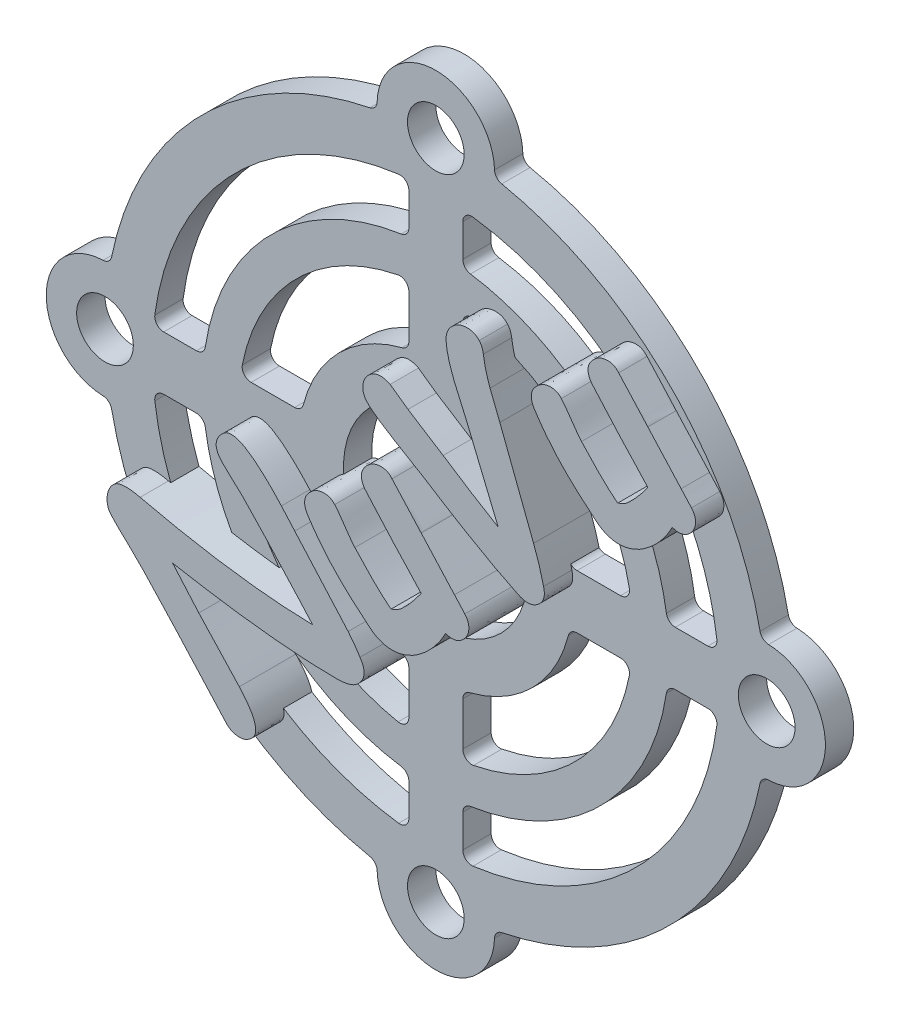
from build123d import *

# Parameters (mm, degrees)
SKETCH1_R           = 2
SKETCH1_R_2         = 6.511212715
BOSS_EXTRUDE1_DEPTH = 2
BOSS_EXTRUDE2_START = -2
BOSS_EXTRUDE2_DEPTH = 4


# Read off the part's stored shape, not the designer's step: Boss-Extrude2
with BuildPart() as part:
    # Sketch1 → Boss-Extrude1 (new body)
    with BuildSketch(Plane.XY):
        with BuildLine():
            ThreePointArc((4.142051136, 23.475771085), (0, 27.486125513), (-4.142051136, 23.475771085))
            ThreePointArc((-4.142051136, 23.475771085), (-4.291564648, 23.086587368), (-4.650214057, 22.87401066))
            ThreePointArc((-4.650214057, 22.87401066), (-16.505224241, 16.505224241), (-22.87401066, 4.650214057))
            ThreePointArc((-22.87401066, 4.650214057), (-23.086587368, 4.291564648), (-23.475771085, 4.142051136))
            ThreePointArc((-23.475771085, 4.142051136), (-27.486125513, 0), (-23.475771085, -4.142051136))
            ThreePointArc((-23.475771085, -4.142051136), (-23.086587368, -4.291564648), (-22.87401066, -4.650214057))
            ThreePointArc((-22.87401066, -4.650214057), (-16.505224241, -16.505224241), (-4.650214057, -22.87401066))
            ThreePointArc((-4.650214057, -22.87401066), (-4.291564648, -23.086587368), (-4.142051136, -23.475771085))
            ThreePointArc((-4.142051136, -23.475771085), (0, -27.486125513), (4.142051136, -23.475771085))
            ThreePointArc((4.142051136, -23.475771085), (4.291564648, -23.086587368), (4.650214057, -22.87401066))
            ThreePointArc((4.650214057, -22.87401066), (16.505224241, -16.505224241), (22.87401066, -4.650214057))
            ThreePointArc((22.87401066, -4.650214057), (23.086587368, -4.291564648), (23.475771085, -4.142051136))
            ThreePointArc((23.475771085, -4.142051136), (27.486125513, 0), (23.475771085, 4.142051136))
            ThreePointArc((23.475771085, 4.142051136), (23.086587368, 4.291564648), (22.87401066, 4.650214057))
            ThreePointArc((22.87401066, 4.650214057), (16.505224241, 16.505224241), (4.650214057, 22.87401066))
            ThreePointArc((4.650214057, 22.87401066), (4.291564648, 23.086587368), (4.142051136, 23.475771085))
        make_face()
        with Locations((23.341911971, 0)):
            Circle(SKETCH1_R, mode=Mode.SUBTRACT)
        with Locations((0, -23.341911971)):
            Circle(SKETCH1_R, mode=Mode.SUBTRACT)
        with Locations((-23.341911971, 0)):
            Circle(SKETCH1_R, mode=Mode.SUBTRACT)
        Circle(SKETCH1_R_2, mode=Mode.SUBTRACT)
        with BuildLine():
            Line((-9.961790789, 1.905), (-13.030671632, 1.905))
            ThreePointArc((-13.030671632, 1.905), (-13.520759158, 2.13621885), (-13.653941254, 2.661490655))
            ThreePointArc((-13.653941254, 2.661490655), (-9.836504569, 9.836504569), (-2.661490655, 13.653941254))
            ThreePointArc((-2.661490655, 13.653941254), (-2.13621885, 13.520759158), (-1.905, 13.030671632))
            Line((-1.905, 13.030671632), (-1.905, 9.961790789))
            ThreePointArc((-1.905, 9.961790789), (-2.038577231, 9.572175328), (-2.383110889, 9.346477205))
            ThreePointArc((-2.383110889, 9.346477205), (-6.82040518, 6.82040518), (-9.346477205, 2.383110889))
            ThreePointArc((-9.346477205, 2.383110889), (-9.572175328, 2.038577231), (-9.961790789, 1.905))
        make_face(mode=Mode.SUBTRACT)
        with BuildLine():
            Line((-9.961790789, -1.905), (-13.030671632, -1.905))
            ThreePointArc((-13.030671632, -1.905), (-13.520759158, -2.13621885), (-13.653941254, -2.661490655))
            ThreePointArc((-13.653941254, -2.661490655), (-9.836504569, -9.836504569), (-2.661490655, -13.653941254))
            ThreePointArc((-2.661490655, -13.653941254), (-2.13621885, -13.520759158), (-1.905, -13.030671632))
            Line((-1.905, -13.030671632), (-1.905, -9.961790789))
            ThreePointArc((-1.905, -9.961790789), (-2.038577231, -9.572175328), (-2.383110889, -9.346477205))
            ThreePointArc((-2.383110889, -9.346477205), (-6.82040518, -6.82040518), (-9.346477205, -2.383110889))
            ThreePointArc((-9.346477205, -2.383110889), (-9.572175328, -2.038577231), (-9.961790789, -1.905))
        make_face(mode=Mode.SUBTRACT)
        with BuildLine():
            Line((1.905, 9.961790789), (1.905, 13.030671632))
            ThreePointArc((1.905, 13.030671632), (2.13621885, 13.520759158), (2.661490655, 13.653941254))
            ThreePointArc((2.661490655, 13.653941254), (9.836504569, 9.836504569), (13.653941254, 2.661490655))
            ThreePointArc((13.653941254, 2.661490655), (13.520759158, 2.13621885), (13.030671632, 1.905))
            Line((13.030671632, 1.905), (9.961790789, 1.905))
            ThreePointArc((9.961790789, 1.905), (9.572175328, 2.038577231), (9.346477205, 2.383110889))
            ThreePointArc((9.346477205, 2.383110889), (6.82040518, 6.82040518), (2.383110889, 9.346477205))
            ThreePointArc((2.383110889, 9.346477205), (2.038577231, 9.572175328), (1.905, 9.961790789))
        make_face(mode=Mode.SUBTRACT)
        with BuildLine():
            Line((9.961790789, -1.905), (13.030671632, -1.905))
            ThreePointArc((13.030671632, -1.905), (13.520759158, -2.13621885), (13.653941254, -2.661490655))
            ThreePointArc((13.653941254, -2.661490655), (9.836504569, -9.836504569), (2.661490655, -13.653941254))
            ThreePointArc((2.661490655, -13.653941254), (2.13621885, -13.520759158), (1.905, -13.030671632))
            Line((1.905, -13.030671632), (1.905, -9.961790789))
            ThreePointArc((1.905, -9.961790789), (2.038577231, -9.572175328), (2.383110889, -9.346477205))
            ThreePointArc((2.383110889, -9.346477205), (6.82040518, -6.82040518), (9.346477205, -2.383110889))
            ThreePointArc((9.346477205, -2.383110889), (9.572175328, -2.038577231), (9.961790789, -1.905))
        make_face(mode=Mode.SUBTRACT)
        with BuildLine():
            Line((-16.893355295, 1.905), (-19.19769843, 1.905))
            ThreePointArc((-19.19769843, 1.905), (-19.67525146, 2.121469114), (-19.827212424, 2.62328944))
            ThreePointArc((-19.827212424, 2.62328944), (-14.142135624, 14.142135624), (-2.62328944, 19.827212424))
            ThreePointArc((-2.62328944, 19.827212424), (-2.121469114, 19.67525146), (-1.905, 19.19769843))
            Line((-1.905, 19.19769843), (-1.905, 16.893355295))
            ThreePointArc((-1.905, 16.893355295), (-2.05876305, 16.479065544), (-2.44558582, 16.265413449))
            ThreePointArc((-2.44558582, 16.265413449), (-11.630661302, 11.630661302), (-16.265413449, 2.44558582))
            ThreePointArc((-16.265413449, 2.44558582), (-16.479065544, 2.05876305), (-16.893355295, 1.905))
        make_face(mode=Mode.SUBTRACT)
        with BuildLine():
            Line((-16.893355295, -1.905), (-19.19769843, -1.905))
            ThreePointArc((-19.19769843, -1.905), (-19.67525146, -2.121469114), (-19.827212424, -2.62328944))
            ThreePointArc((-19.827212424, -2.62328944), (-14.142135624, -14.142135624), (-2.62328944, -19.827212424))
            ThreePointArc((-2.62328944, -19.827212424), (-2.121469114, -19.67525146), (-1.905, -19.19769843))
            Line((-1.905, -19.19769843), (-1.905, -16.893355295))
            ThreePointArc((-1.905, -16.893355295), (-2.05876305, -16.479065544), (-2.44558582, -16.265413449))
            ThreePointArc((-2.44558582, -16.265413449), (-11.630661302, -11.630661302), (-16.265413449, -2.44558582))
            ThreePointArc((-16.265413449, -2.44558582), (-16.479065544, -2.05876305), (-16.893355295, -1.905))
        make_face(mode=Mode.SUBTRACT)
        with BuildLine():
            Line((1.905, 16.893355295), (1.905, 19.19769843))
            ThreePointArc((1.905, 19.19769843), (2.121469114, 19.67525146), (2.62328944, 19.827212424))
            ThreePointArc((2.62328944, 19.827212424), (14.142135624, 14.142135624), (19.827212424, 2.62328944))
            ThreePointArc((19.827212424, 2.62328944), (19.67525146, 2.121469114), (19.19769843, 1.905))
            Line((19.19769843, 1.905), (16.893355295, 1.905))
            ThreePointArc((16.893355295, 1.905), (16.479065544, 2.05876305), (16.265413449, 2.44558582))
            ThreePointArc((16.265413449, 2.44558582), (11.630661302, 11.630661302), (2.44558582, 16.265413449))
            ThreePointArc((2.44558582, 16.265413449), (2.05876305, 16.479065544), (1.905, 16.893355295))
        make_face(mode=Mode.SUBTRACT)
        with BuildLine():
            Line((1.905, -16.893355295), (1.905, -19.19769843))
            ThreePointArc((1.905, -19.19769843), (2.121469114, -19.67525146), (2.62328944, -19.827212424))
            ThreePointArc((2.62328944, -19.827212424), (14.142135624, -14.142135624), (19.827212424, -2.62328944))
            ThreePointArc((19.827212424, -2.62328944), (19.67525146, -2.121469114), (19.19769843, -1.905))
            Line((19.19769843, -1.905), (16.893355295, -1.905))
            ThreePointArc((16.893355295, -1.905), (16.479065544, -2.05876305), (16.265413449, -2.44558582))
            ThreePointArc((16.265413449, -2.44558582), (11.630661302, -11.630661302), (2.44558582, -16.265413449))
            ThreePointArc((2.44558582, -16.265413449), (2.05876305, -16.479065544), (1.905, -16.893355295))
        make_face(mode=Mode.SUBTRACT)
        with BuildLine():
            ThreePointArc((0, 25.341911971), (-1.444189317, 21.958323443), (1.998163772, 23.256229187))
            ThreePointArc((1.998163772, 23.256229187), (1.444189317, 24.7255005), (0, 25.341911971))
        make_face(mode=Mode.SUBTRACT)
    extrude(amount=BOSS_EXTRUDE1_DEPTH)

    # Boss-Extrude2 outline → Boss-Extrude2 (add)
    with BuildSketch(Plane.XY.offset(2).offset(BOSS_EXTRUDE2_START)):
        with BuildLine():
            add(Edge.make_bspline(
                [(-7.952972933, -3.641911337), (-7.830138747, -3.781206227), (-7.590593042, -4.052852858), (-7.240831947, -4.451010242), (-6.905379607, -4.826385854), (-6.590258394, -5.184313096), (-6.292319924, -5.521232132), (-6.012727395, -5.837302729), (-5.750957135, -6.133702264), (-5.505732508, -6.408533587), (-5.281481464, -6.666476817), (-5.071956207, -6.9003705), (-4.882005474, -7.116062421), (-4.705506042, -7.307397225), (-4.552586947, -7.48420682), (-4.41401583, -7.637478445), (-4.293053896, -7.770884261), (-4.219588264, -7.854111728), (-4.1857036, -7.892498857)],
                knots=[0, 0, 0, 0, 0.098094022, 0.191298549, 0.279918503, 0.36399329, 0.443178607, 0.51747446, 0.58688086, 0.652047129, 0.712019608, 0.767407079, 0.817905188, 0.863821415, 0.904884984, 0.941364819, 0.972955608, 1, 1, 1, 1], degree=3))
            add(Edge.make_bspline(
                [(-8.893484, -2.578611325), (-8.88384894, -2.589011527), (-8.855338663, -2.619785871), (-8.802460367, -2.682519416), (-8.719120291, -2.770213785), (-8.617247774, -2.891755178), (-8.484954724, -3.036681692), (-8.330583118, -3.213163533), (-8.151717175, -3.419039616), (-8.021947798, -3.564562949), (-7.952972933, -3.641911337)],
                knots=[0, 0, 0, 0, 0.029958341, 0.088647152, 0.173322162, 0.285506617, 0.42366598, 0.587960845, 0.78099344, 1, 1, 1, 1], degree=3))
            add(Edge.make_bspline(
                [(-12.989932206, -0.185533164), (-12.94448893, -0.14817682), (-12.85482639, -0.074470322), (-12.69245497, -0.008037712), (-12.518316117, 0.030433409), (-12.328462343, 0.031110398), (-12.123691192, -0.002566043), (-11.904441366, -0.068928681), (-11.670708145, -0.170659881), (-11.422114584, -0.305071186), (-11.159302558, -0.474091462), (-10.878111033, -0.671839784), (-10.587531227, -0.910576115), (-10.274667799, -1.174890577), (-9.953157849, -1.481123686), (-9.609816896, -1.813645098), (-9.254799331, -2.183456101), (-9.016581554, -2.443984761), (-8.893484, -2.578611325)],
                knots=[0, 0, 0, 0, 0.034447789, 0.067967728, 0.102051264, 0.138962514, 0.178909684, 0.22383522, 0.273441684, 0.328712966, 0.390005396, 0.457281989, 0.53093344, 0.611275463, 0.698316041, 0.792201487, 0.892621412, 1, 1, 1, 1], degree=3))
            add(Edge.make_bspline(
                [(-13.15417234, -1.917125554), (-13.201768381, -1.859711036), (-13.302371801, -1.733917722), (-13.42116071, -1.523163482), (-13.491657592, -1.291923667), (-13.506185307, -1.061607324), (-13.462252079, -0.832746752), (-13.358882478, -0.608471629), (-13.199932106, -0.387187335), (-13.062897782, -0.255598971), (-12.989932206, -0.185533164)],
                knots=[0.033497037, 0.033497037, 0.033497037, 0.033497037, 0.142535772, 0.269186179, 0.384924547, 0.493454852, 0.603700601, 0.722377591, 0.852176607, 1, 1, 1, 1], degree=3))
            ThreePointArc((-13.15417234, -1.917125554), (-13.0927189, -1.908038659), (-13.030671632, -1.905))
            Line((-13.030671632, -1.905), (-9.961790789, -1.905))
            ThreePointArc((-9.961790789, -1.905), (-9.572175328, -2.038577231), (-9.346477205, -2.383110889))
            ThreePointArc((-9.346477205, -2.383110889), (-7.168363584, -6.45371344), (-3.348018702, -9.045807008))
            add(Edge.make_bspline(
                [(-4.1857036, -7.892498857), (-4.130156836, -7.957260454), (-4.004175549, -8.104141183), (-3.811184021, -8.363945819), (-3.586030095, -8.682673735), (-3.431386951, -8.91859969), (-3.348018702, -9.045807008)],
                knots=[0, 0, 0, 0, 0.179163764, 0.406347368, 0.679375824, 0.998802688, 0.998802688, 0.998802688, 0.998802688], degree=3))
        make_face()
        with BuildLine():
            add(Edge.make_bspline(
                [(-3.348018702, -9.045807008), (-3.347706212, -9.04628382), (-3.347393722, -9.046760633), (-3.347081232, -9.047237446)],
                knots=[0.998802688, 0.998802688, 0.998802688, 0.998802688, 1, 1, 1, 1], degree=3))
            ThreePointArc((-3.348018702, -9.045807008), (-7.168363584, -6.45371344), (-9.346477205, -2.383110889))
            ThreePointArc((-9.346477205, -2.383110889), (-9.572175328, -2.038577231), (-9.961790789, -1.905))
            Line((-9.961790789, -1.905), (-13.030671632, -1.905))
            ThreePointArc((-13.030671632, -1.905), (-13.0927189, -1.908038659), (-13.15417234, -1.917125554))
            add(Edge.make_bspline(
                [(-13.110108621, -1.969891661), (-13.124829655, -1.952327567), (-13.139550689, -1.934763472), (-13.15417234, -1.917125554)],
                knots=[0, 0, 0, 0, 0.033497037, 0.033497037, 0.033497037, 0.033497037], degree=3))
            add(Edge.make_bspline(
                [(-12.394275197, -2.656987247), (-12.468478951, -2.590130983), (-12.608143807, -2.464295429), (-12.802269769, -2.283958079), (-12.967776341, -2.122701812), (-13.065177705, -2.018130192), (-13.110108621, -1.969891661)],
                knots=[0, 0, 0, 0, 0.301857621, 0.568150516, 0.800789311, 1, 1, 1, 1], degree=3))
            add(Edge.make_bspline(
                [(-11.673216712, -3.320570056), (-11.711358958, -3.282941354), (-11.800384397, -3.195114547), (-11.959758861, -3.047947777), (-12.1616142, -2.86399382), (-12.312256505, -2.729962127), (-12.394275197, -2.656987247)],
                knots=[0, 0, 0, 0, 0.16400097, 0.382784445, 0.663950887, 1, 1, 1, 1], degree=3))
            add(Edge.make_bspline(
                [(-7.602893813, -7.714846767), (-7.725139303, -7.581033204), (-7.964258785, -7.319285882), (-8.310106142, -6.929667989), (-8.649038416, -6.564542776), (-8.965804331, -6.208552381), (-9.275831804, -5.877262542), (-9.564333821, -5.556447478), (-9.841723118, -5.257224063), (-10.103324945, -4.973715275), (-10.35112986, -4.709369515), (-10.581341373, -4.458155758), (-10.800520741, -4.228706071), (-11.001904409, -4.011338438), (-11.19228602, -3.815829231), (-11.364237145, -3.633420783), (-11.524536937, -3.472325114), (-11.625380482, -3.369395727), (-11.673216712, -3.320570056)],
                knots=[0, 0, 0, 0, 0.090770468, 0.177552459, 0.260900938, 0.340259436, 0.416186926, 0.488122675, 0.55633416, 0.620527464, 0.681319351, 0.737796659, 0.791171036, 0.840229863, 0.886189827, 0.927833247, 0.965766917, 1, 1, 1, 1], degree=3))
            add(Edge.make_bspline(
                [(-6.691120584, -8.736346287), (-6.709531383, -8.715552171), (-6.752113656, -8.667457532), (-6.820792431, -8.58323415), (-6.91198559, -8.484276417), (-7.016971362, -8.364728245), (-7.140860291, -8.228989289), (-7.279930785, -8.073742211), (-7.435171299, -7.899868001), (-7.545334307, -7.778342898), (-7.602893813, -7.714846767)],
                knots=[0, 0, 0, 0, 0.060845347, 0.140728989, 0.238015712, 0.355583189, 0.48931671, 0.640635278, 0.812234105, 1, 1, 1, 1], degree=3))
            add(Edge.make_bspline(
                [(-11.063197867, -8.43322579), (-11.009649463, -8.43943999), (-10.473638222, -8.500685251), (-9.46898069, -8.596693462), (-8.06487309, -8.698917744), (-7.143245897, -8.724027917), (-6.691120584, -8.736346287)],
                knots=[0.643935213, 0.643935213, 0.643935213, 0.643935213, 0.657070137, 0.775387425, 0.889811161, 1, 1, 1, 1], degree=3))
            ThreePointArc((-11.063197867, -8.43322579), (-9.853945707, -9.819032452), (-8.472439833, -11.033195708))
            add(Edge.make_bspline(
                [(-5.037388623, -11.186900125), (-5.232467594, -11.185860998), (-5.628781583, -11.183749952), (-6.231482984, -11.167305449), (-6.852471118, -11.141269456), (-7.490752117, -11.103820994), (-8.033131875, -11.067672287), (-8.362014693, -11.042143766), (-8.472439833, -11.033195708)],
                knots=[0, 0, 0, 0, 0.050388515, 0.102367124, 0.155725282, 0.210925426, 0.267514655, 0.296130816, 0.296130816, 0.296130816, 0.296130816], degree=3))
            add(Edge.make_bspline(
                [(-3.527345853, -10.771507737), (-3.568498955, -10.804593949), (-3.652624829, -10.872229349), (-3.795215727, -10.960019544), (-3.958059575, -11.028673719), (-4.138350731, -11.086197381), (-4.336274479, -11.134064046), (-4.554330168, -11.162633409), (-4.789578118, -11.185795771), (-4.952849036, -11.186523379), (-5.037388623, -11.186900125)],
                knots=[0, 0, 0, 0, 0.098975589, 0.202327589, 0.312765512, 0.429484919, 0.557035531, 0.693993699, 0.841553862, 1, 1, 1, 1], degree=3))
            add(Edge.make_bspline(
                [(-3.347081232, -9.047237446), (-3.298635055, -9.126111587), (-3.206382782, -9.276305458), (-3.109473171, -9.511968733), (-3.060267028, -9.742274204), (-3.059156105, -9.966869859), (-3.108178639, -10.18302377), (-3.202815768, -10.391216748), (-3.343413331, -10.591662307), (-3.464271507, -10.709834941), (-3.527345853, -10.771507737)],
                knots=[0, 0, 0, 0, 0.14400734, 0.274221937, 0.394721626, 0.508653217, 0.621195792, 0.737151961, 0.862822948, 1, 1, 1, 1], degree=3))
        make_face()
        with BuildLine():
            ThreePointArc((-8.472439833, -11.033195708), (-9.853945707, -9.819032452), (-11.063197867, -8.43322579))
            add(Edge.make_bspline(
                [(-14.400179875, -7.948546045), (-14.248927748, -7.97487886), (-13.58351401, -8.088139215), (-12.471800007, -8.255402878), (-11.509314509, -8.38145472), (-11.063197867, -8.43322579)],
                knots=[0.370044474, 0.370044474, 0.370044474, 0.370044474, 0.407451735, 0.534506967, 0.643935213, 0.643935213, 0.643935213, 0.643935213], degree=3))
            ThreePointArc((-14.400179875, -7.948546045), (-13.568434868, -9.297426519), (-12.610743454, -10.560005406))
            add(Edge.make_bspline(
                [(-8.472439833, -11.033195708), (-8.587566061, -11.023866708), (-8.933637568, -10.994592231), (-9.517438006, -10.939487143), (-10.228791975, -10.863090342), (-10.958762859, -10.780107112), (-11.705953825, -10.685727106), (-12.258511161, -10.61022476), (-12.562106533, -10.566979457), (-12.610743454, -10.560005406)],
                knots=[0.296130816, 0.296130816, 0.296130816, 0.296130816, 0.325965242, 0.38583895, 0.447593006, 0.510762643, 0.575603065, 0.64212175, 0.654813134, 0.654813134, 0.654813134, 0.654813134], degree=3))
        make_face()
        with BuildLine():
            ThreePointArc((-12.610743454, -10.560005406), (-13.568434868, -9.297426519), (-14.400179875, -7.948546045))
            add(Edge.make_bspline(
                [(-18.709321045, -7.068331208), (-18.199434601, -7.185663405), (-17.145641856, -7.42672801), (-15.707268303, -7.711912846), (-14.779713434, -7.882469703), (-14.400179875, -7.948546045)],
                knots=[0.01279887, 0.01279887, 0.01279887, 0.01279887, 0.140273223, 0.276179276, 0.370044474, 0.370044474, 0.370044474, 0.370044474], degree=3))
            ThreePointArc((-18.709321045, -7.068331208), (-15.522804921, -12.611206421), (-10.749960948, -16.865299868))
            add(Edge.make_bspline(
                [(-11.866543987, -15.108308771), (-11.797426236, -15.187274853), (-11.663537193, -15.340241248), (-11.474328885, -15.566996406), (-11.30768989, -15.786284082), (-11.159982111, -15.995504096), (-11.034056584, -16.196799498), (-10.929176423, -16.389617739), (-10.845262458, -16.574033159), (-10.784256315, -16.730547574), (-10.758565186, -16.827904573), (-10.749960948, -16.865299868)],
                knots=[0, 0, 0, 0, 0.09964103, 0.19301615, 0.280333667, 0.361077268, 0.43610193, 0.505655417, 0.569295761, 0.628425417, 0.664829705, 0.664829705, 0.664829705, 0.664829705], degree=3))
            add(Edge.make_bspline(
                [(-14.722040089, -12.030747555), (-14.680279968, -12.076938907), (-14.592634713, -12.173884333), (-14.452480147, -12.327203391), (-14.297380697, -12.495196467), (-14.12592522, -12.679102604), (-13.941225443, -12.880125749), (-13.740844105, -13.096833817), (-13.522275281, -13.326857582), (-13.295584501, -13.569515347), (-13.068974582, -13.812248195), (-12.850184896, -14.042066881), (-12.650131857, -14.259888423), (-12.462602275, -14.459092556), (-12.291312339, -14.643961034), (-12.136079233, -14.811830004), (-11.995954616, -14.96517687), (-11.908305804, -15.062118993), (-11.866543987, -15.108308771)],
                knots=[0, 0, 0, 0, 0.044496333, 0.093387958, 0.148434304, 0.207877584, 0.273053875, 0.343506384, 0.418781774, 0.499788285, 0.580794797, 0.656070187, 0.726522696, 0.792122416, 0.851565696, 0.906612042, 0.955503667, 1, 1, 1, 1], degree=3))
            add(Edge.make_bspline(
                [(-16.566486794, -9.909372591), (-16.447004922, -10.046814094), (-16.220561175, -10.307295188), (-15.901627435, -10.679595663), (-15.618321994, -11.009187219), (-15.365351015, -11.292285857), (-15.155531158, -11.538439641), (-14.979774058, -11.740619252), (-14.838855151, -11.899358729), (-14.756877954, -11.991563343), (-14.722040089, -12.030747555)],
                knots=[0, 0, 0, 0, 0.194350452, 0.368335745, 0.523170047, 0.658156837, 0.773475334, 0.868333145, 0.944045512, 1, 1, 1, 1], degree=3))
            add(Edge.make_bspline(
                [(-12.610743454, -10.560005406), (-12.823482778, -10.529500703), (-13.303801894, -10.45863845), (-14.057052454, -10.339936671), (-14.87766957, -10.207446945), (-15.716334568, -10.063776136), (-16.280935965, -9.961233962), (-16.566486794, -9.909372591)],
                knots=[0.654813134, 0.654813134, 0.654813134, 0.654813134, 0.710325622, 0.780221106, 0.851777764, 0.92503564, 1, 1, 1, 1], degree=3))
        make_face()
        with BuildLine():
            ThreePointArc((-10.749960948, -16.865299868), (-15.522804921, -12.611206421), (-18.709321045, -7.068331208))
            add(Edge.make_bspline(
                [(-18.862901318, -7.032976243), (-18.811708371, -7.044763444), (-18.760515425, -7.056550645), (-18.709321045, -7.068331208)],
                knots=[0, 0, 0, 0, 0.01279887, 0.01279887, 0.01279887, 0.01279887], degree=3))
            add(Edge.make_bspline(
                [(-20.699510431, -7.153152657), (-20.656253674, -7.119146807), (-20.566006045, -7.048199571), (-20.400209255, -6.973217862), (-20.208185246, -6.925744839), (-19.99053465, -6.899890548), (-19.746492169, -6.899883122), (-19.474698202, -6.917449029), (-19.176373829, -6.963542089), (-18.97063354, -7.009113558), (-18.862901318, -7.032976243)],
                knots=[0, 0, 0, 0, 0.086467131, 0.180398487, 0.283915548, 0.397279585, 0.524912842, 0.667957176, 0.826131714, 1, 1, 1, 1], degree=3))
            add(Edge.make_bspline(
                [(-20.887612644, -9.159576268), (-20.942794687, -9.091390505), (-21.052280812, -8.956103832), (-21.15024475, -8.708743742), (-21.200987262, -8.439174876), (-21.195216937, -8.151482808), (-21.146151084, -7.863623392), (-21.0448926, -7.595852572), (-20.900156289, -7.352236948), (-20.767116551, -7.220232619), (-20.699510431, -7.153152657)],
                knots=[0, 0, 0, 0, 0.11793033, 0.233984355, 0.354929513, 0.486740235, 0.620630702, 0.747625272, 0.87175203, 1, 1, 1, 1], degree=3))
            add(Edge.make_bspline(
                [(-18.630386082, -11.390677523), (-18.697922792, -11.318024162), (-18.848058829, -11.156513663), (-19.105417615, -10.899037747), (-19.412902681, -10.598576836), (-19.758999363, -10.275126895), (-20.105096045, -9.951676955), (-20.412581111, -9.651216044), (-20.669939897, -9.393740128), (-20.820075935, -9.232229629), (-20.887612644, -9.159576268)],
                knots=[0, 0, 0, 0, 0.093734921, 0.20837541, 0.343974922, 0.5, 0.656025078, 0.79162459, 0.906265079, 1, 1, 1, 1], degree=3))
            add(Edge.make_bspline(
                [(-16.344421681, -13.854294014), (-16.414827022, -13.776667205), (-16.571343765, -13.604096558), (-16.83293679, -13.322239124), (-17.144710229, -12.990401135), (-17.488371027, -12.623476852), (-17.834004703, -12.258324715), (-18.141012535, -11.921996041), (-18.403615753, -11.641016022), (-18.560027825, -11.468348092), (-18.630386082, -11.390677523)],
                knots=[0, 0, 0, 0, 0.09354588, 0.207960024, 0.343248259, 0.499979904, 0.656711549, 0.792039976, 0.90645412, 1, 1, 1, 1], degree=3))
            add(Edge.make_bspline(
                [(-14.243946963, -16.179446376), (-14.309267895, -16.107173284), (-14.454796743, -15.946155682), (-14.694407848, -15.68066461), (-14.977311481, -15.365395145), (-15.29159164, -15.019500605), (-15.606585005, -14.672593255), (-15.890584547, -14.35665567), (-16.131729669, -14.089235514), (-16.278216008, -13.927425393), (-16.344421681, -13.854294014)],
                knots=[0, 0, 0, 0, 0.093269646, 0.207795934, 0.342401428, 0.498822435, 0.655243441, 0.791026438, 0.905552726, 1, 1, 1, 1], degree=3))
            add(Edge.make_bspline(
                [(-12.807055054, -17.767865068), (-12.851679068, -17.719287451), (-12.95139416, -17.610737788), (-13.111343465, -17.426212134), (-13.30879919, -17.2140527), (-13.523748107, -16.976172022), (-13.736243456, -16.736078993), (-13.934303589, -16.522819497), (-14.097742772, -16.338980828), (-14.198550236, -16.228982179), (-14.243946963, -16.179446376)],
                knots=[0, 0, 0, 0, 0.092384423, 0.206438654, 0.341980133, 0.498279107, 0.655484444, 0.791025923, 0.905892493, 1, 1, 1, 1], degree=3))
            add(Edge.make_bspline(
                [(-11.991945462, -18.188482518), (-12.069341744, -18.176682641), (-12.221945153, -18.153416646), (-12.438076134, -18.065729982), (-12.638329463, -17.939841932), (-12.749929002, -17.826091916), (-12.807055054, -17.767865068)],
                knots=[0, 0, 0, 0, 0.24955675, 0.492054789, 0.739990821, 1, 1, 1, 1], degree=3))
            add(Edge.make_bspline(
                [(-11.007021372, -17.835790868), (-11.081531748, -17.896440852), (-11.225415226, -18.01355918), (-11.470967367, -18.133092685), (-11.729061938, -18.198579937), (-11.903650874, -18.191873934), (-11.991945462, -18.188482518)],
                knots=[0, 0, 0, 0, 0.266901193, 0.515400323, 0.754924166, 1, 1, 1, 1], degree=3))
            add(Edge.make_bspline(
                [(-10.749960948, -16.865299868), (-10.745672918, -16.883936282), (-10.730636809, -16.954381229), (-10.711092023, -17.07460752), (-10.708137193, -17.224139013), (-10.725949777, -17.365339819), (-10.766534069, -17.496875559), (-10.823013033, -17.622211537), (-10.906404652, -17.735133349), (-10.973038367, -17.801794082), (-11.007021372, -17.835790868)],
                knots=[0.664829705, 0.664829705, 0.664829705, 0.664829705, 0.682972237, 0.733138056, 0.78027557, 0.824479014, 0.867641678, 0.910550162, 0.954380837, 1, 1, 1, 1], degree=3))
        make_face()
        with BuildLine():
            add(Edge.make_bspline(
                [(-7.047368785, -2.196274575), (-7.086100933, -2.127667586), (-7.160215642, -1.996386792), (-7.233324056, -1.789155931), (-7.262769195, -1.584963359), (-7.252479607, -1.385128754), (-7.201835823, -1.190074697), (-7.10720238, -1.001851851), (-6.97095321, -0.819905833), (-6.858300163, -0.709966507), (-6.799178365, -0.652268905)],
                knots=[0, 0, 0, 0, 0.136706757, 0.261591009, 0.37927467, 0.492910826, 0.607039459, 0.726805496, 0.856623937, 1, 1, 1, 1], degree=3))
            add(Edge.make_bspline(
                [(-5.487687931, -4.254948801), (-5.616344237, -4.109035514), (-5.882836038, -3.806798523), (-6.266237047, -3.312528292), (-6.663183125, -2.776005939), (-6.916722252, -2.393418563), (-7.047368785, -2.196274575)],
                knots=[0, 0, 0, 0, 0.225691575, 0.467485477, 0.725599842, 1, 1, 1, 1], degree=3))
            add(Edge.make_bspline(
                [(-2.63741689, -6.906667506), (-2.911811858, -6.68062186), (-3.44468568, -6.24164221), (-4.190502694, -5.567686603), (-4.873533578, -4.916356044), (-5.287705874, -4.47031743), (-5.487687931, -4.254948801)],
                knots=[0, 0, 0, 0, 0.273674073, 0.531473849, 0.773773319, 1, 1, 1, 1], degree=3))
            add(Edge.make_bspline(
                [(-0.630993279, -7.437011247), (-0.722240198, -7.450347521), (-0.90147223, -7.476543338), (-1.170586363, -7.48079827), (-1.43256789, -7.457864187), (-1.68851136, -7.405036314), (-1.936853607, -7.323231089), (-2.180167969, -7.215428298), (-2.415992338, -7.076838919), (-2.562789109, -6.964021195), (-2.63741689, -6.906667506)],
                knots=[0, 0, 0, 0, 0.128968423, 0.253326609, 0.375715654, 0.496442291, 0.618253294, 0.741030222, 0.868346288, 1, 1, 1, 1], degree=3))
            add(Edge.make_bspline(
                [(1.26309151, -6.42857438), (1.187182031, -6.494766079), (1.037739619, -6.625077173), (0.80542872, -6.801805134), (0.572018909, -6.960913981), (0.334702691, -7.095995881), (0.09596888, -7.210993786), (-0.143086244, -7.309602262), (-0.385291801, -7.385717771), (-0.549682704, -7.420036575), (-0.630993279, -7.437011247)],
                knots=[0, 0, 0, 0, 0.138997379, 0.273643078, 0.402676507, 0.528672629, 0.650184539, 0.768276629, 0.885385625, 1, 1, 1, 1], degree=3))
            add(Edge.make_bspline(
                [(1.317095074, -6.376609725), (1.299103262, -6.393940377), (1.281097386, -6.411257378), (1.26309151, -6.42857438)],
                knots=[0.968187084, 0.968187084, 0.968187084, 0.968187084, 1, 1, 1, 1], degree=3))
            ThreePointArc((1.317095074, -6.376609725), (-3.940464037, -5.183496329), (-6.496550261, -0.43672157))
            add(Edge.make_bspline(
                [(-6.799178365, -0.652268905), (-6.734790316, -0.598287535), (-6.639436809, -0.518345479), (-6.532266342, -0.455520297), (-6.496550261, -0.43672157)],
                knots=[0, 0, 0, 0, 0.135647164, 0.20088251, 0.20088251, 0.20088251, 0.20088251], degree=3))
        make_face()
        with BuildLine():
            add(Edge.make_bspline(
                [(-6.496550261, -0.43672157), (-6.461479194, -0.418262339), (-6.354714533, -0.368035303), (-6.167872871, -0.304035533), (-5.934184638, -0.277837441), (-5.705239495, -0.288213094), (-5.489098515, -0.346283943), (-5.293905813, -0.454989576), (-5.188512525, -0.559840235), (-5.134996281, -0.613080944)],
                knots=[0.20088251, 0.20088251, 0.20088251, 0.20088251, 0.264939738, 0.391112245, 0.518943753, 0.64321142, 0.760187218, 0.878228684, 1, 1, 1, 1], degree=3))
            ThreePointArc((-6.496550261, -0.43672157), (-3.940464037, -5.183496329), (1.317095074, -6.376609725))
            add(Edge.make_bspline(
                [(2.694758358, -4.573677552), (2.599136512, -4.745174468), (2.408415714, -5.087230496), (2.072460762, -5.570260711), (1.705596851, -5.999608821), (1.441523087, -6.256754173), (1.317095074, -6.376609725)],
                knots=[0, 0, 0, 0, 0.250042076, 0.498716834, 0.748174891, 0.968187084, 0.968187084, 0.968187084, 0.968187084], degree=3))
            add(Edge.make_bspline(
                [(3.901747561, -4.346387377), (3.857347413, -4.384110405), (3.771475858, -4.457068158), (3.63054424, -4.545462858), (3.484734194, -4.6077199), (3.334325325, -4.647775556), (3.180225695, -4.667581068), (3.021105569, -4.65704079), (2.857322952, -4.629585012), (2.750069508, -4.592699565), (2.694758358, -4.573677552)],
                knots=[0, 0, 0, 0, 0.134307613, 0.259755967, 0.382174744, 0.49866197, 0.618041923, 0.738750323, 0.865272205, 1, 1, 1, 1], degree=3))
            add(Edge.make_bspline(
                [(4.042824221, -2.703105539), (4.092693972, -2.763897799), (4.189662933, -2.882104972), (4.285774992, -3.089832006), (4.333346454, -3.310173148), (4.331994177, -3.538704249), (4.287954145, -3.763709439), (4.202471487, -3.978880436), (4.073309516, -4.176897059), (3.959719795, -4.289115167), (3.901747561, -4.346387377)],
                knots=[0, 0, 0, 0, 0.127712785, 0.248330416, 0.368847838, 0.49230353, 0.61809404, 0.740361489, 0.867489556, 1, 1, 1, 1], degree=3))
            add(Edge.make_bspline(
                [(3.316540675, -1.89844607), (3.339093308, -1.923781114), (3.389105857, -1.979963914), (3.473700046, -2.070596539), (3.569188706, -2.181282451), (3.677320445, -2.30133908), (3.786225371, -2.420604542), (3.887433816, -2.527701207), (3.969351268, -2.621535426), (4.020124001, -2.677903618), (4.042824221, -2.703105539)],
                knots=[0, 0, 0, 0, 0.093870045, 0.208165501, 0.343066272, 0.498381916, 0.655315959, 0.790044388, 0.906129955, 1, 1, 1, 1], degree=3))
            add(Edge.make_bspline(
                [(0.967043124, 0.701099436), (1.03783588, 0.622676961), (1.198286508, 0.444943144), (1.46590804, 0.149609995), (1.782963919, -0.20545771), (2.135687862, -0.595574136), (2.490168821, -0.983217034), (2.809531393, -1.337784318), (3.079793527, -1.63621155), (3.243408485, -1.817440723), (3.316540675, -1.89844607)],
                knots=[0.002974689, 0.002974689, 0.002974689, 0.002974689, 0.093159226, 0.207370482, 0.343186211, 0.49950153, 0.656316279, 0.791579565, 0.906840774, 1, 1, 1, 1], degree=3))
            add(Edge.make_bspline(
                [(-1.093411221, 2.981761359), (-1.003709347, 2.882489726), (-0.831335804, 2.691726677), (-0.581751321, 2.415354217), (-0.349861466, 2.161206878), (-0.138283266, 1.92525939), (0.054909562, 1.710908714), (0.231087957, 1.51774251), (0.385885187, 1.342664153), (0.525211972, 1.191881513), (0.643828676, 1.06040771), (0.742130286, 0.947661181), (0.824904543, 0.85687781), (0.888892125, 0.790155052), (0.933607771, 0.735930828), (0.956067666, 0.716762395), (0.96646689, 0.701934626), (0.967043124, 0.701099436)],
                knots=[0, 0, 0, 0, 0.129618596, 0.249078593, 0.360763458, 0.462915513, 0.556100345, 0.640318159, 0.716195609, 0.782480333, 0.839231474, 0.887644383, 0.927653599, 0.957505189, 0.979014277, 0.991556123, 0.992330856, 0.992330856, 0.992330856, 0.992330856], degree=3))
            add(Edge.make_bspline(
                [(-2.783718612, 2.976536298), (-2.718603794, 3.031582776), (-2.591135284, 3.139341547), (-2.369965752, 3.251003248), (-2.138726785, 3.3236956), (-1.899548975, 3.352444134), (-1.664301471, 3.336287792), (-1.445039599, 3.269328744), (-1.247743008, 3.152995559), (-1.145609056, 3.0396759), (-1.093411221, 2.981761359)],
                knots=[0, 0, 0, 0, 0.134604215, 0.263500683, 0.389109959, 0.516872972, 0.642724212, 0.759614547, 0.877145648, 1, 1, 1, 1], degree=3))
            add(Edge.make_bspline(
                [(-3.013621317, 1.406405321), (-3.05707429, 1.474739396), (-3.139664959, 1.604621348), (-3.219423826, 1.813006512), (-3.259213268, 2.017815675), (-3.249980098, 2.22100794), (-3.200089131, 2.420988844), (-3.101140613, 2.613978584), (-2.964365293, 2.805082961), (-2.845933509, 2.917487598), (-2.783718612, 2.976536298)],
                knots=[0, 0, 0, 0, 0.137144954, 0.260670161, 0.376349694, 0.488772691, 0.603132082, 0.723440612, 0.854717094, 1, 1, 1, 1], degree=3))
            add(Edge.make_bspline(
                [(-1.015035298, -0.84559618), (-1.203282771, -0.636724802), (-1.565782051, -0.234511039), (-2.087465399, 0.349026373), (-2.56415873, 0.891939403), (-2.86825628, 1.240016928), (-3.013621317, 1.406405321)],
                knots=[0, 0, 0, 0, 0.280156407, 0.539483982, 0.779863638, 1, 1, 1, 1], degree=3))
            add(Edge.make_bspline(
                [(-0.043173862, -1.893221009), (-0.148808976, -1.781126774), (-0.344040563, -1.573957639), (-0.609089664, -1.285314215), (-0.830833642, -1.051355973), (-0.958690253, -0.908535597), (-1.015035298, -0.84559618)],
                knots=[0, 0, 0, 0, 0.323346149, 0.597598461, 0.822665934, 1, 1, 1, 1], degree=3))
            add(Edge.make_bspline(
                [(0.962650475, -2.993096452), (0.886937953, -2.909449295), (0.730559767, -2.736682752), (0.486725514, -2.469329215), (0.227080554, -2.186425903), (0.048300849, -1.992463912), (-0.043173862, -1.893221009)],
                knots=[0, 0, 0, 0, 0.227094099, 0.469044787, 0.728330603, 1, 1, 1, 1], degree=3))
            add(Edge.make_bspline(
                [(-0.427215881, -4.612865513), (-0.30727585, -4.49940598), (-0.061457312, -4.266869301), (0.287885022, -3.879818547), (0.633245022, -3.454194884), (0.851047371, -3.149317352), (0.962650475, -2.993096452)],
                knots=[0, 0, 0, 0, 0.231524749, 0.474512758, 0.730737489, 1, 1, 1, 1], degree=3))
            add(Edge.make_bspline(
                [(-1.158724489, -5.012582717), (-1.087789668, -4.98564787), (-0.950181616, -4.933396357), (-0.755561635, -4.841627524), (-0.578139169, -4.739854017), (-0.476632462, -4.654445164), (-0.427215881, -4.612865513)],
                knots=[0, 0, 0, 0, 0.271305381, 0.526311396, 0.769393845, 1, 1, 1, 1], degree=3))
            add(Edge.make_bspline(
                [(-3.711167026, -2.525453449), (-3.582032695, -2.667977779), (-3.33211806, -2.943806181), (-2.960019665, -3.333938512), (-2.612767916, -3.696389773), (-2.284636007, -4.025946247), (-1.973910215, -4.319663948), (-1.686718938, -4.583263179), (-1.41763185, -4.810819209), (-1.241869628, -4.947788673), (-1.158724489, -5.012582717)],
                knots=[0, 0, 0, 0, 0.161684137, 0.31290852, 0.45322841, 0.583688171, 0.703834142, 0.812673801, 0.911384468, 1, 1, 1, 1], degree=3))
            add(Edge.make_bspline(
                [(-5.134996281, -0.613080944), (-5.088236692, -0.666576787), (-4.983000389, -0.786973585), (-4.822788812, -1.000390089), (-4.638064245, -1.26199709), (-4.437555647, -1.556874299), (-4.233178817, -1.852675695), (-4.041164032, -2.117809037), (-3.872216371, -2.339821096), (-3.761378471, -2.467577592), (-3.711167026, -2.525453449)],
                knots=[0, 0, 0, 0, 0.089316219, 0.201013502, 0.335308527, 0.492033987, 0.649381746, 0.787371493, 0.903675685, 1, 1, 1, 1], degree=3))
        make_face()
        with BuildLine():
            ThreePointArc((6.424862289, 1.056899041), (3.351624898, 5.58233836), (-2.08729759, 6.167582978))
            add(Edge.make_bspline(
                [(-0.972648033, 5.448092723), (-1.089707276, 5.518919249), (-1.314664082, 5.655029039), (-1.631146953, 5.859282038), (-1.887581425, 6.025529076), (-2.033881098, 6.129381139), (-2.08729759, 6.167582978)],
                knots=[0, 0, 0, 0, 0.175791097, 0.337823847, 0.484000308, 0.568376867, 0.568376867, 0.568376867, 0.568376867], degree=3))
            add(Edge.make_bspline(
                [(1.1461144, 4.188852905), (0.793670897, 4.400014578), (0.088905041, 4.82226534), (-0.618837562, 5.239507504), (-0.972648033, 5.448092723)],
                knots=[0, 0, 0, 0, 0.50008595, 1, 1, 1, 1], degree=3))
            add(Edge.make_bspline(
                [(6.424862289, 1.056899041), (6.185595889, 1.183705019), (5.675512263, 1.458951856), (4.881556311, 1.907943536), (4.019391063, 2.407629748), (3.108829707, 2.962201664), (2.141723444, 3.555247612), (1.484265686, 3.973653529), (1.1461144, 4.188852905)],
                knots=[0.202729761, 0.202729761, 0.202729761, 0.202729761, 0.308216957, 0.428525531, 0.558051136, 0.696409476, 0.843853807, 1, 1, 1, 1], degree=3))
        make_face()
        with BuildLine():
            add(Edge.make_bspline(
                [(-2.08729759, 6.167582978), (-2.11721964, 6.188982312), (-2.221534406, 6.26389651), (-2.392045625, 6.384770091), (-2.578461981, 6.536977191), (-2.736418476, 6.671911078), (-2.823844412, 6.76412642), (-2.864120291, 6.80660871)],
                knots=[0.568376867, 0.568376867, 0.568376867, 0.568376867, 0.615641663, 0.733369318, 0.836825525, 0.924827851, 1, 1, 1, 1], degree=3))
            ThreePointArc((-2.08729759, 6.167582978), (3.351624898, 5.58233836), (6.424862289, 1.056899041))
            add(Edge.make_bspline(
                [(7.82113045, 0.358882835), (7.603682304, 0.462153295), (7.147331435, 0.678883423), (6.685505233, 0.918897264), (6.438314153, 1.049769846), (6.424862289, 1.056899041)],
                knots=[0, 0, 0, 0, 0.093773476, 0.196799136, 0.202729761, 0.202729761, 0.202729761, 0.202729761], degree=3))
            add(Edge.make_bspline(
                [(9.29459779, 0.536534925), (9.24097962, 0.491298221), (9.137168047, 0.403714227), (8.964984024, 0.30356009), (8.787963657, 0.233679889), (8.604007879, 0.197286537), (8.414386701, 0.188899908), (8.218861586, 0.213905992), (8.018081104, 0.26908159), (7.888326644, 0.328244186), (7.82113045, 0.358882835)],
                knots=[0, 0, 0, 0, 0.132254572, 0.256061614, 0.374237069, 0.490008547, 0.608503889, 0.731081829, 0.860734823, 1, 1, 1, 1], degree=3))
            add(Edge.make_bspline(
                [(9.600263887, 1.751361721), (9.614631716, 1.689779188), (9.642337309, 1.571029133), (9.661405179, 1.394786334), (9.656988011, 1.22753547), (9.627295457, 1.069423606), (9.578609922, 0.920122637), (9.505980602, 0.780978155), (9.411055537, 0.652006529), (9.334005654, 0.575609091), (9.29459779, 0.536534925)],
                knots=[0, 0, 0, 0, 0.143103215, 0.275946991, 0.400246166, 0.520538735, 0.639023514, 0.754567107, 0.874471112, 1, 1, 1, 1], degree=3))
            add(Edge.make_bspline(
                [(9.518030115, 2.08579579), (9.54594798, 1.974450117), (9.573105933, 1.862905919), (9.600263887, 1.751361721)],
                knots=[0.855818251, 0.855818251, 0.855818251, 0.855818251, 1, 1, 1, 1], degree=3))
            ThreePointArc((9.518030115, 2.08579579), (9.411782936, 2.222641587), (9.346477205, 2.383110889))
            ThreePointArc((9.346477205, 2.383110889), (7.546801141, 6.006799995), (4.419241225, 8.573573388))
            add(Edge.make_bspline(
                [(6.399913726, 3.778685578), (6.288597556, 4.053933804), (6.07184479, 4.589892006), (5.75301436, 5.371000423), (5.450266185, 6.107864421), (5.162339604, 6.799598506), (4.893186104, 7.448712412), (4.648448827, 8.035498087), (4.491274163, 8.405415374), (4.419241225, 8.573573388)],
                knots=[0, 0, 0, 0, 0.153381571, 0.298661729, 0.435841525, 0.564922207, 0.685732007, 0.798859268, 0.89336448, 0.89336448, 0.89336448, 0.89336448], degree=3))
            add(Edge.make_bspline(
                [(2.51508051, 6.213564231), (2.864658837, 5.98463104), (3.544070763, 5.539695161), (4.541496262, 4.904647435), (5.486843967, 4.321731519), (6.102495927, 3.955574065), (6.399913726, 3.778685578)],
                knots=[0, 0, 0, 0, 0.273395702, 0.53134959, 0.773597776, 1, 1, 1, 1], degree=3))
            add(Edge.make_bspline(
                [(0.035788834, 7.78892027), (0.109829507, 7.742796111), (0.265902647, 7.645569248), (0.512620151, 7.49098062), (0.783580102, 7.318248736), (1.081415283, 7.130155601), (1.405679057, 6.927372723), (1.753368494, 6.704277301), (2.125940608, 6.464565239), (2.382728938, 6.298932958), (2.51508051, 6.213564231)],
                knots=[0, 0, 0, 0, 0.089088533, 0.187793095, 0.29734153, 0.41725879, 0.547545349, 0.687925753, 0.839153449, 1, 1, 1, 1], degree=3))
            add(Edge.make_bspline(
                [(-1.223450984, 8.687630846), (-1.012766342, 8.53689153), (-0.593372869, 8.236826538), (-0.173272019, 7.937752702), (0.035788834, 7.78892027)],
                knots=[0, 0, 0, 0, 0.502355557, 1, 1, 1, 1], degree=3))
            add(Edge.make_bspline(
                [(-2.702143385, 8.52826647), (-2.649309798, 8.57246998), (-2.546138079, 8.658789165), (-2.375757415, 8.759458841), (-2.196713959, 8.82515236), (-2.012571216, 8.86391266), (-1.821623021, 8.864246271), (-1.625472187, 8.837751272), (-1.422925862, 8.779881664), (-1.291505275, 8.719103801), (-1.223450984, 8.687630846)],
                knots=[0, 0, 0, 0, 0.129553267, 0.25298743, 0.370223839, 0.487253746, 0.605301173, 0.72771868, 0.859002972, 1, 1, 1, 1], degree=3))
            add(Edge.make_bspline(
                [(-3.146273612, 7.705319286), (-3.130795998, 7.783649897), (-3.100227831, 7.938352248), (-3.0048147, 8.156455121), (-2.874752598, 8.357921721), (-2.760178725, 8.470992497), (-2.702143385, 8.52826647)],
                knots=[0, 0, 0, 0, 0.250562596, 0.494859187, 0.744129982, 1, 1, 1, 1], degree=3))
            add(Edge.make_bspline(
                [(-2.864120291, 6.80660871), (-2.916047514, 6.870751883), (-3.017960342, 6.996639842), (-3.115340487, 7.219210664), (-3.162379452, 7.458802744), (-3.151745015, 7.621573793), (-3.146273612, 7.705319286)],
                knots=[0, 0, 0, 0, 0.253836142, 0.498181059, 0.741814808, 1, 1, 1, 1], degree=3))
        make_face()
        with BuildLine():
            ThreePointArc((9.346477205, 2.383110889), (9.411782936, 2.222641587), (9.518030115, 2.08579579))
            add(Edge.make_bspline(
                [(8.897493117, 4.03210106), (8.965819015, 3.850549518), (9.103601823, 3.484441178), (9.288778749, 2.921607595), (9.424304027, 2.453274364), (9.496378512, 2.172149536), (9.518030115, 2.08579579)],
                knots=[0, 0, 0, 0, 0.24362613, 0.491285046, 0.743998601, 0.855818251, 0.855818251, 0.855818251, 0.855818251], degree=3))
            add(Edge.make_bspline(
                [(6.517477609, 10.229023984), (6.587079927, 10.046121972), (6.734623181, 9.658405603), (6.969838435, 9.044493137), (7.23091926, 8.366374487), (7.51649153, 7.623853683), (7.822802695, 6.816027296), (8.16199544, 5.946692268), (8.521899197, 5.011163868), (8.769533205, 4.365654889), (8.897493117, 4.03210106)],
                knots=[0, 0, 0, 0, 0.088440888, 0.187477324, 0.297109558, 0.416829118, 0.547003639, 0.687548051, 0.838546717, 1, 1, 1, 1], degree=3))
            add(Edge.make_bspline(
                [(5.825156962, 11.984644644), (5.829447022, 11.972428716), (5.843972548, 11.931067344), (5.87996474, 11.843879396), (5.933425843, 11.703136198), (6.00989493, 11.510080837), (6.105665915, 11.263802519), (6.22797725, 10.966645831), (6.364003214, 10.614381689), (6.464105858, 10.363034713), (6.517477609, 10.229023984)],
                knots=[0, 0, 0, 0, 0.020579393, 0.069678858, 0.149885826, 0.259910952, 0.399754662, 0.569930307, 0.770699636, 1, 1, 1, 1], degree=3))
            add(Edge.make_bspline(
                [(5.579278494, 12.743048919), (5.605013328, 12.652684072), (5.681775619, 12.398180626), (5.768856108, 12.147025806), (5.825156962, 11.984644644)],
                knots=[0.580904318, 0.580904318, 0.580904318, 0.580904318, 0.729038672, 1, 1, 1, 1], degree=3))
            ThreePointArc((5.579278494, 12.743048919), (4.18220265, 13.267359393), (2.737003047, 13.639005044))
            add(Edge.make_bspline(
                [(2.711020316, 13.405861369), (2.717934714, 13.483888851), (2.724849112, 13.561916334), (2.737003047, 13.639005044)],
                knots=[0, 0, 0, 0, 0.196060037, 0.196060037, 0.196060037, 0.196060037], degree=3))
            add(Edge.make_bspline(
                [(3.259651772, 11.229623259), (3.182657556, 11.434158811), (3.036011212, 11.823725619), (2.873058359, 12.394392126), (2.755245067, 12.914815275), (2.725181301, 13.248625967), (2.711020316, 13.405861369)],
                knots=[0, 0, 0, 0, 0.290913026, 0.55408489, 0.789959869, 1, 1, 1, 1], degree=3))
            add(Edge.make_bspline(
                [(4.174037532, 9.142211195), (4.022794935, 9.48980227), (3.719712661, 10.186356651), (3.413206676, 10.881411297), (3.259651772, 11.229623259)],
                knots=[0, 0, 0, 0, 0.499014986, 1, 1, 1, 1], degree=3))
            add(Edge.make_bspline(
                [(4.419241225, 8.573573388), (4.411534013, 8.591565566), (4.330195587, 8.781282055), (4.248230411, 8.970728706), (4.174037532, 9.142211195)],
                knots=[0.89336448, 0.89336448, 0.89336448, 0.89336448, 0.903476127, 1, 1, 1, 1], degree=3))
            ThreePointArc((4.419241225, 8.573573388), (7.546801141, 6.006799995), (9.346477205, 2.383110889))
        make_face()
        with BuildLine():
            ThreePointArc((2.737003047, 13.639005044), (4.18220265, 13.267359393), (5.579278494, 12.743048919))
            add(Edge.make_bspline(
                [(5.352288897, 13.823866288), (5.373992332, 13.679847177), (5.418589763, 13.383908664), (5.501726557, 13.024651435), (5.560317768, 12.80962728), (5.579278494, 12.743048919)],
                knots=[0, 0, 0, 0, 0.229584451, 0.471762957, 0.580904318, 0.580904318, 0.580904318, 0.580904318], degree=3))
            add(Edge.make_bspline(
                [(5.057072923, 14.508349342), (5.09549593, 14.461702652), (5.172165027, 14.368624055), (5.256025159, 14.202737933), (5.319252039, 14.020808814), (5.341109881, 13.890507725), (5.352288897, 13.823866288)],
                knots=[0, 0, 0, 0, 0.238998307, 0.476896156, 0.732462774, 1, 1, 1, 1], degree=3))
            add(Edge.make_bspline(
                [(3.194338503, 14.46393632), (3.264690598, 14.522401995), (3.403195738, 14.63750584), (3.642328523, 14.761350285), (3.897829531, 14.837114832), (4.161653105, 14.871043381), (4.421915235, 14.860738415), (4.664951274, 14.797087775), (4.883046953, 14.681350068), (4.998651489, 14.566426597), (5.057072923, 14.508349342)],
                knots=[0, 0, 0, 0, 0.132657376, 0.26116818, 0.388098564, 0.518244463, 0.646236888, 0.764130736, 0.880802074, 1, 1, 1, 1], degree=3))
            add(Edge.make_bspline(
                [(2.737003047, 13.639005044), (2.740830602, 13.663282063), (2.7625013, 13.783838502), (2.831792921, 13.994515435), (2.98265785, 14.252500476), (3.123012069, 14.392692375), (3.194338503, 14.46393632)],
                knots=[0.196060037, 0.196060037, 0.196060037, 0.196060037, 0.257803879, 0.50385214, 0.747863244, 1, 1, 1, 1], degree=3))
        make_face()
        with BuildLine():
            add(Edge.make_bspline(
                [(14.898168132, 17.455650694), (14.987870006, 17.356379061), (15.160243549, 17.165616012), (15.409828031, 16.889243552), (15.641717887, 16.635096213), (15.853296087, 16.399148725), (16.046488915, 16.184798048), (16.22266731, 15.991631844), (16.37746454, 15.816553488), (16.516791325, 15.665770847), (16.635408029, 15.534297045), (16.733709639, 15.421550516), (16.816483896, 15.330767144), (16.880471478, 15.264044387), (16.925187124, 15.209820162), (16.947647019, 15.19065173), (16.958046243, 15.175823961), (16.958622477, 15.174988771)],
                knots=[0, 0, 0, 0, 0.129618596, 0.249078593, 0.360763458, 0.462915513, 0.556100345, 0.640318159, 0.716195609, 0.782480333, 0.839231474, 0.887644383, 0.927653599, 0.957505189, 0.979014277, 0.991556123, 0.992330856, 0.992330856, 0.992330856, 0.992330856], degree=3))
            add(Edge.make_bspline(
                [(13.207860741, 17.450425632), (13.272975558, 17.505472111), (13.400444069, 17.613230882), (13.621613601, 17.724892583), (13.852852567, 17.797584934), (14.092030378, 17.826333468), (14.327277882, 17.810177126), (14.546539754, 17.743218079), (14.743836345, 17.626884893), (14.845970296, 17.513565235), (14.898168132, 17.455650694)],
                knots=[0, 0, 0, 0, 0.134604215, 0.263500683, 0.389109959, 0.516872972, 0.642724212, 0.759614547, 0.877145648, 1, 1, 1, 1], degree=3))
            add(Edge.make_bspline(
                [(12.977958036, 15.880294655), (12.934505063, 15.94862873), (12.851914394, 16.078510683), (12.772155527, 16.286895846), (12.732366085, 16.49170501), (12.741599254, 16.694897275), (12.791490222, 16.894878178), (12.89043874, 17.087867918), (13.02721406, 17.278972296), (13.145645844, 17.391376932), (13.207860741, 17.450425632)],
                knots=[0, 0, 0, 0, 0.137144954, 0.260670161, 0.376349694, 0.488772691, 0.603132082, 0.723440612, 0.854717094, 1, 1, 1, 1], degree=3))
            add(Edge.make_bspline(
                [(14.976544054, 13.628293154), (14.788296582, 13.837164533), (14.425797302, 14.239378295), (13.904113954, 14.822915708), (13.427420622, 15.365828738), (13.123323073, 15.713906263), (12.977958036, 15.880294655)],
                knots=[0, 0, 0, 0, 0.280156407, 0.539483982, 0.779863638, 1, 1, 1, 1], degree=3))
            add(Edge.make_bspline(
                [(15.948405491, 12.580668326), (15.842770377, 12.692762561), (15.64753879, 12.899931695), (15.382489689, 13.188575119), (15.160745711, 13.422533362), (15.032889099, 13.565353738), (14.976544054, 13.628293154)],
                knots=[0, 0, 0, 0, 0.323346149, 0.597598461, 0.822665934, 1, 1, 1, 1], degree=3))
            add(Edge.make_bspline(
                [(16.954229827, 11.480792883), (16.878517306, 11.564440039), (16.722139119, 11.737206583), (16.478304867, 12.00456012), (16.218659907, 12.287463431), (16.039880202, 12.481425422), (15.948405491, 12.580668326)],
                knots=[0, 0, 0, 0, 0.227094099, 0.469044787, 0.728330603, 1, 1, 1, 1], degree=3))
            add(Edge.make_bspline(
                [(16.656370891, 11.070921767), (16.757845611, 11.205896237), (16.856037719, 11.34334456), (16.954229827, 11.480792883)],
                knots=[0.763093922, 0.763093922, 0.763093922, 0.763093922, 1, 1, 1, 1], degree=3))
            ThreePointArc((16.656370891, 11.070921767), (17.34743569, 9.953214305), (17.963609851, 8.792537809))
            add(Edge.make_bspline(
                [(18.68633771, 9.900211783), (18.590715864, 9.728714866), (18.399995066, 9.386658838), (18.147480404, 9.023597628), (17.99513866, 8.831317034), (17.963609851, 8.792537809)],
                knots=[0, 0, 0, 0, 0.250042076, 0.498716834, 0.562352568, 0.562352568, 0.562352568, 0.562352568], degree=3))
            add(Edge.make_bspline(
                [(19.893326914, 10.127501958), (19.848926765, 10.089778929), (19.763055211, 10.016821176), (19.622123593, 9.928426477), (19.476313547, 9.866169435), (19.325904678, 9.826113778), (19.171805048, 9.806308267), (19.012684922, 9.816848545), (18.848902305, 9.844304322), (18.74164886, 9.881189769), (18.68633771, 9.900211783)],
                knots=[0, 0, 0, 0, 0.134307613, 0.259755967, 0.382174744, 0.49866197, 0.618041923, 0.738750323, 0.865272205, 1, 1, 1, 1], degree=3))
            add(Edge.make_bspline(
                [(20.034403574, 11.770783795), (20.084273325, 11.709991535), (20.181242286, 11.591784363), (20.277354345, 11.384057329), (20.324925807, 11.163716186), (20.32357353, 10.935185085), (20.279533498, 10.710179896), (20.19405084, 10.495008898), (20.064888869, 10.296992275), (19.951299148, 10.184774168), (19.893326914, 10.127501958)],
                knots=[0, 0, 0, 0, 0.127712785, 0.248330416, 0.368847838, 0.49230353, 0.61809404, 0.740361489, 0.867489556, 1, 1, 1, 1], degree=3))
            add(Edge.make_bspline(
                [(19.308120027, 12.575443264), (19.330672661, 12.550108221), (19.38068521, 12.493925421), (19.465279399, 12.403292796), (19.560768059, 12.292606883), (19.668899798, 12.172550255), (19.777804723, 12.053284792), (19.879013169, 11.946188128), (19.96093062, 11.852353909), (20.011703353, 11.795985716), (20.034403574, 11.770783795)],
                knots=[0, 0, 0, 0, 0.093870045, 0.208165501, 0.343066272, 0.498381916, 0.655315959, 0.790044388, 0.906129955, 1, 1, 1, 1], degree=3))
            add(Edge.make_bspline(
                [(16.958622477, 15.174988771), (17.029415233, 15.096566296), (17.189865861, 14.918832479), (17.457487393, 14.62349933), (17.774543272, 14.268431624), (18.127267215, 13.878315199), (18.481748174, 13.4906723), (18.801110746, 13.136105017), (19.07137288, 12.837677784), (19.234987837, 12.656448611), (19.308120027, 12.575443264)],
                knots=[0.002974689, 0.002974689, 0.002974689, 0.002974689, 0.093159226, 0.207370482, 0.343186211, 0.49950153, 0.656316279, 0.791579565, 0.906840774, 1, 1, 1, 1], degree=3))
        make_face()
        with BuildLine():
            add(Edge.make_bspline(
                [(17.963609851, 8.792537809), (17.871542766, 8.67929883), (17.644907239, 8.420621542), (17.397202018, 8.182393108), (17.254670863, 8.045314955)],
                knots=[0.562352568, 0.562352568, 0.562352568, 0.562352568, 0.748174891, 1, 1, 1, 1], degree=3))
            ThreePointArc((17.963609851, 8.792537809), (17.34743569, 9.953214305), (16.656370891, 11.070921767))
            add(Edge.make_bspline(
                [(15.564363472, 9.861023822), (15.684303503, 9.974483355), (15.930122041, 10.207020033), (16.279464375, 10.594070788), (16.518356557, 10.888482896), (16.642511559, 11.052487067), (16.656370891, 11.070921767)],
                knots=[0, 0, 0, 0, 0.231524749, 0.474512758, 0.730737489, 0.763093922, 0.763093922, 0.763093922, 0.763093922], degree=3))
            add(Edge.make_bspline(
                [(14.832854864, 9.461306618), (14.903789685, 9.488241465), (15.041397737, 9.540492978), (15.236017718, 9.632261811), (15.413440184, 9.734035317), (15.514946891, 9.81944417), (15.564363472, 9.861023822)],
                knots=[0, 0, 0, 0, 0.271305381, 0.526311396, 0.769393845, 1, 1, 1, 1], degree=3))
            add(Edge.make_bspline(
                [(12.280412327, 11.948435886), (12.409546657, 11.805911556), (12.659461293, 11.530083154), (13.031559688, 11.139950823), (13.378811437, 10.777499561), (13.706943346, 10.447943088), (14.017669137, 10.154225387), (14.304860414, 9.890626156), (14.573947503, 9.663070126), (14.749709725, 9.526100662), (14.832854864, 9.461306618)],
                knots=[0, 0, 0, 0, 0.161684137, 0.31290852, 0.45322841, 0.583688171, 0.703834142, 0.812673801, 0.911384468, 1, 1, 1, 1], degree=3))
            add(Edge.make_bspline(
                [(10.856583072, 13.86080839), (10.90334266, 13.807312547), (11.008578964, 13.68691575), (11.168790541, 13.473499246), (11.353515108, 13.211892245), (11.554023705, 12.917015035), (11.758400536, 12.621213639), (11.950415321, 12.356080298), (12.119362982, 12.134068238), (12.230200881, 12.006311743), (12.280412327, 11.948435886)],
                knots=[0, 0, 0, 0, 0.089316219, 0.201013502, 0.335308527, 0.492033987, 0.649381746, 0.787371493, 0.903675685, 1, 1, 1, 1], degree=3))
            add(Edge.make_bspline(
                [(9.192400988, 13.821620429), (9.256789037, 13.8756018), (9.382548782, 13.981035704), (9.598543017, 14.09272748), (9.823706482, 14.169853802), (10.057394715, 14.196051894), (10.286339857, 14.18567624), (10.502480838, 14.127605392), (10.69767354, 14.018899758), (10.803066828, 13.9140491), (10.856583072, 13.86080839)],
                knots=[0, 0, 0, 0, 0.135647164, 0.264939738, 0.391112245, 0.518943753, 0.64321142, 0.760187218, 0.878228684, 1, 1, 1, 1], degree=3))
            add(Edge.make_bspline(
                [(9.083188566, 13.712776893), (9.118798683, 13.749791144), (9.155599836, 13.785705787), (9.192400988, 13.821620429)],
                knots=[0.910753656, 0.910753656, 0.910753656, 0.910753656, 1, 1, 1, 1], degree=3))
            ThreePointArc((9.083188566, 13.712776893), (12.446317827, 10.753312847), (14.886176009, 6.996165269))
            add(Edge.make_bspline(
                [(15.360586074, 7.036878088), (15.269339155, 7.023541814), (15.112007016, 7.000546795), (14.952965472, 6.995526455), (14.886176009, 6.996165269)],
                knots=[0, 0, 0, 0, 0.128968423, 0.222373293, 0.222373293, 0.222373293, 0.222373293], degree=3))
            add(Edge.make_bspline(
                [(17.254670863, 8.045314955), (17.178761384, 7.979123255), (17.029318972, 7.848812162), (16.797008073, 7.6720842), (16.563598262, 7.512975353), (16.326282044, 7.377893453), (16.087548233, 7.262895549), (15.848493109, 7.164287072), (15.606287551, 7.088171563), (15.441896649, 7.05385276), (15.360586074, 7.036878088)],
                knots=[0, 0, 0, 0, 0.138997379, 0.273643078, 0.402676507, 0.528672629, 0.650184539, 0.768276629, 0.885385625, 1, 1, 1, 1], degree=3))
        make_face()
        with BuildLine():
            add(Edge.make_bspline(
                [(14.886176009, 6.996165269), (14.864042738, 6.996376965), (14.754402267, 6.998920473), (14.559011462, 7.016025148), (14.303067992, 7.068853021), (14.054725745, 7.150658245), (13.811411384, 7.258461036), (13.575587014, 7.397050415), (13.428790244, 7.509868139), (13.354162463, 7.567221829)],
                knots=[0.222373293, 0.222373293, 0.222373293, 0.222373293, 0.253326609, 0.375715654, 0.496442291, 0.618253294, 0.741030222, 0.868346288, 1, 1, 1, 1], degree=3))
            ThreePointArc((14.886176009, 6.996165269), (12.446317827, 10.753312847), (9.083188566, 13.712776893))
            add(Edge.make_bspline(
                [(8.944210567, 12.27761476), (8.90547842, 12.346221749), (8.83136371, 12.477502542), (8.758255297, 12.684733404), (8.728810158, 12.888925975), (8.739099746, 13.08876058), (8.78974353, 13.283814638), (8.884376973, 13.472037484), (8.989682221, 13.612661243), (9.061590307, 13.690326999), (9.083188566, 13.712776893)],
                knots=[0, 0, 0, 0, 0.136706757, 0.261591009, 0.37927467, 0.492910826, 0.607039459, 0.726805496, 0.856623937, 0.910753656, 0.910753656, 0.910753656, 0.910753656], degree=3))
            add(Edge.make_bspline(
                [(10.503891421, 10.218940534), (10.375235116, 10.36485382), (10.108743315, 10.667090811), (9.725342306, 11.161361043), (9.328396228, 11.697883395), (9.074857101, 12.080470772), (8.944210567, 12.27761476)],
                knots=[0, 0, 0, 0, 0.225691575, 0.467485477, 0.725599842, 1, 1, 1, 1], degree=3))
            add(Edge.make_bspline(
                [(13.354162463, 7.567221829), (13.079767495, 7.793267474), (12.546893673, 8.232247125), (11.801076659, 8.906202732), (11.118045774, 9.557533291), (10.703873479, 10.003571904), (10.503891421, 10.218940534)],
                knots=[0, 0, 0, 0, 0.273674073, 0.531473849, 0.773773319, 1, 1, 1, 1], degree=3))
        make_face()
    extrude(amount=BOSS_EXTRUDE2_DEPTH)


solid = part.part
